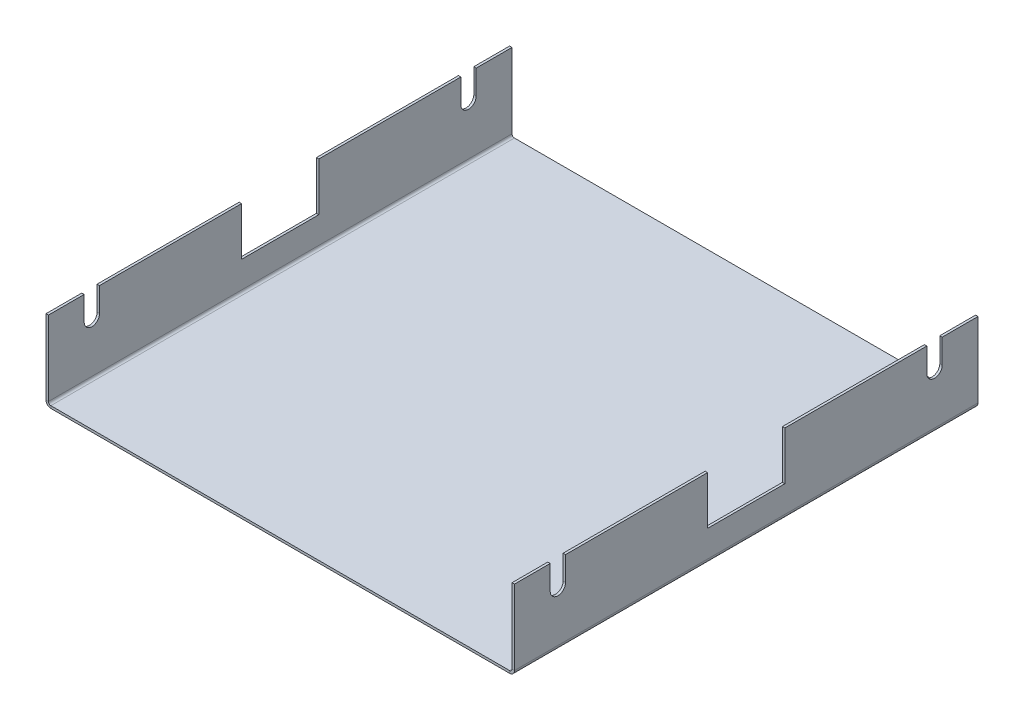
from build123d import *

# Parameters (mm, degrees)
BASE_FLANGE1_DEPTH      = 152.4
SKETCH6_W               = 50.8
SKETCH6_H               = 31.75
CUT_EXTRUDE1_DEPTH      = 348.354286896
F_3_8_CLEARANCE_HOLE1_D = 10.0838
SKETCH8_W               = 10.0838
SKETCH8_H               = 15.875
CUT_EXTRUDE2_DEPTH      = 348.354286896


# Sheet-metal steps are written as plain solids
with BuildPart() as part:
    # Sketch1 → Base-Flange1 (new, symmetric)
    with BuildSketch(Plane.XY):
        with BuildLine():
            Line((-152.4, 50.8), (-152.4, 1.5875))
            ThreePointArc((-152.4, 1.5875), (-151.935032015, 0.464967985), (-150.8125, 0))
            Line((-150.8125, 0), (150.8125, 0))
            ThreePointArc((150.8125, 0), (151.935032015, 0.464967985), (152.4, 1.5875))
            Line((152.4, 1.5875), (152.4, 50.8))
            Line((152.4, 50.8), (153.9875, 50.8))
            Line((153.9875, 50.8), (153.9875, 1.5875))
            ThreePointArc((153.9875, 1.5875), (153.05756403, -0.65756403), (150.8125, -1.5875))
            Line((150.8125, -1.5875), (-150.8125, -1.5875))
            ThreePointArc((-150.8125, -1.5875), (-153.05756403, -0.65756403), (-153.9875, 1.5875))
            Line((-153.9875, 1.5875), (-153.9875, 50.8))
            Line((-153.9875, 50.8), (-152.4, 50.8))
        make_face()
    extrude(amount=BASE_FLANGE1_DEPTH, both=True)

    # Sketch6 → Cut-Extrude1 (cut, through all)
    with BuildSketch(Plane(origin=(153.9875, 0, 0), x_dir=(0, 0, -1), z_dir=(1, 0, 0))):
        with Locations((0, 34.925)):
            Rectangle(SKETCH6_W, SKETCH6_H)
    extrude(amount=-CUT_EXTRUDE1_DEPTH, mode=Mode.SUBTRACT)

    # 3/8 Clearance Hole1 (through all)
    with Locations(Plane(origin=(153.9875, 34.925, 123.825), x_dir=(0, 0, 1), z_dir=(1, 0, 0))):
        with Locations((0, 0), (-247.65, 0)):
            Hole(F_3_8_CLEARANCE_HOLE1_D / 2)

    # Sketch8 → Cut-Extrude2 (cut, through all)
    with BuildSketch(Plane(origin=(153.9875, 0, 0), x_dir=(0, 0, -1), z_dir=(1, 0, 0))):
        with Locations((-123.825, 42.8625)):
            Rectangle(SKETCH8_W, SKETCH8_H)
        with Locations((123.825, 42.8625)):
            Rectangle(SKETCH8_W, SKETCH8_H)
    extrude(amount=-CUT_EXTRUDE2_DEPTH, mode=Mode.SUBTRACT)


solid = part.part
